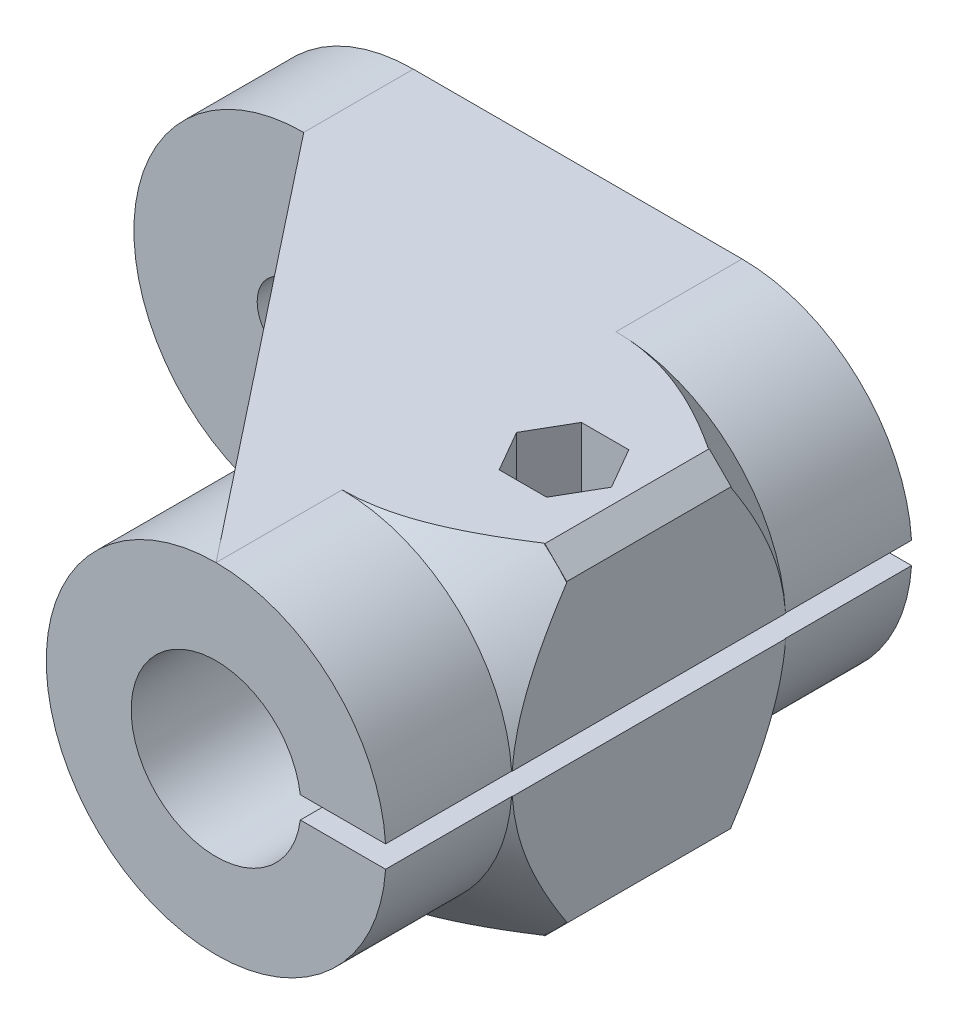
from build123d import *
from build123d.topology import SkipClean

# Parameters (mm, degrees)
SKETCH1_R                    = 7.75
BOSS_EXTRUDE1_DEPTH          = 48
CUT_EXTRUDE2_START           = -38
CUT_EXTRUDE2_DEPTH           = 38
BOSS_EXTRUDE4_DEPTH          = 3
BOSS_EXTRUDE5_DEPTH          = 7.5
SKETCH12_R                   = 2.25
CUT_EXTRUDE6_DEPTH           = 40
CUT_EXTRUDE7_DEPTH           = 8
SKETCH14_R                   = 3.75
CUT_EXTRUDE8_DEPTH           = 10
CUT_EXTRUDE_THIN2_DEPTH      = 68.930111237
CUT_EXTRUDE_THIN2_DEPTH_BACK = 63
SKETCH15_W                   = 30.528675624
SKETCH15_H                   = 2
CHAMFER4_SIZE                = 5
CHAMFER5_SIZE                = 2


with BuildPart() as part:
    # Sketch1 → Boss-Extrude1 (new body)
    with BuildSketch(Plane.XY):
        with BuildLine():
            Line((0, 15.5), (-30, 15.5))
            ThreePointArc((-30, 15.5), (-40.960155108, 10.960155108), (-45.5, 0))
            ThreePointArc((-45.5, 0), (-40.960155108, -10.960155108), (-30, -15.5))
            Line((-30, -15.5), (0, -15.5))
            ThreePointArc((0, -15.5), (10.960155108, -10.960155108), (15.5, 0))
            ThreePointArc((15.5, 0), (10.960155108, 10.960155108), (0, 15.5))
        make_face()
        Circle(SKETCH1_R, mode=Mode.SUBTRACT)
        with BuildLine():
            Line((-31, 3.25), (-29, 3.25))
            ThreePointArc((-29, 3.25), (-25.75, 0), (-29, -3.25))
            Line((-29, -3.25), (-31, -3.25))
            ThreePointArc((-31, -3.25), (-34.25, 0), (-31, 3.25))
        make_face(mode=Mode.SUBTRACT)
    extrude(amount=BOSS_EXTRUDE1_DEPTH)

    # Sketch4 → Cut-Extrude2 (cut)
    with SkipClean():  # the faces are left unmerged after this step: merging them gives an invalid solid
        with BuildSketch(Plane.XY.offset(48).offset(CUT_EXTRUDE2_START)):
            with BuildLine():
                Line((0, 15.5), (-30, 15.5))
                ThreePointArc((-30, 15.5), (-45.5, 0), (-30, -15.5))
                Line((-30, -15.5), (0, -15.5))
                ThreePointArc((0, -15.5), (-15.5, 0), (0, 15.5))
            make_face()
        extrude(amount=CUT_EXTRUDE2_DEPTH, mode=Mode.SUBTRACT)

    # Sketch10 → Boss-Extrude4 (add)
    with BuildSketch(Plane(origin=(0, 15.5, 0), x_dir=(1, 0, 0), z_dir=(0, 1, 0))):
        Polygon((-30, 0), (0, 0), (0, -48), (-30, -10), align=None)
    boss_extrude4 = extrude(amount=-BOSS_EXTRUDE4_DEPTH)

    # Mirror3: Boss-Extrude4 across plane
    add(boss_extrude4.mirror(Plane.ZX))

    # Sketch11 → Boss-Extrude5 (add, symmetric)
    with BuildSketch(Plane.XY.offset(24)):
        with BuildLine():
            Line((15.5, -15.5), (15.5, 0))
            ThreePointArc((15.5, 0), (10.960155108, -10.960155108), (0, -15.5))
            Line((0, -15.5), (15.5, -15.5))
        make_face()
        with BuildLine():
            Line((15.5, 15.5), (0, 15.5))
            ThreePointArc((0, 15.5), (10.960155108, 10.960155108), (15.5, 0))
            Line((15.5, 0), (15.5, 15.5))
        make_face()
    extrude(amount=BOSS_EXTRUDE5_DEPTH, both=True)

    # Sketch12 → Cut-Extrude6 (cut)
    with BuildSketch(Plane(origin=(0, -15.5, 0), x_dir=(-1, 0, 0), z_dir=(0, -1, 0))):
        with Locations((-7.75, -24)):
            Circle(SKETCH12_R)
    extrude(amount=-CUT_EXTRUDE6_DEPTH, mode=Mode.SUBTRACT)

    # Sketch13 → Cut-Extrude7 (cut)
    with BuildSketch(Plane(origin=(0, 15.5, 0), x_dir=(1, 0, 0), z_dir=(0, 1, 0))):
        Polygon((3.419872981, -24), (5.584936491, -27.75), (9.915063509, -27.75), (12.080127019, -24), (9.915063509, -20.25), (5.584936491, -20.25), align=None)
    extrude(amount=-CUT_EXTRUDE7_DEPTH, mode=Mode.SUBTRACT)

    # Sketch14 → Cut-Extrude8 (cut)
    with BuildSketch(Plane(origin=(0, -15.5, 0), x_dir=(-1, 0, 0), z_dir=(0, -1, 0))):
        with Locations((-7.75, -24)):
            Circle(SKETCH14_R)
    extrude(amount=-CUT_EXTRUDE8_DEPTH, mode=Mode.SUBTRACT)

    # Sketch15 → Cut-Extrude-Thin2 (cut, two sides: drawn at the far end of the back side and taken through both)
    with BuildSketch(Plane.XY.offset(48).offset(-CUT_EXTRUDE_THIN2_DEPTH_BACK)):
        with Locations((15.264337812, 0)):
            Rectangle(SKETCH15_W, SKETCH15_H)
    extrude(amount=CUT_EXTRUDE_THIN2_DEPTH + CUT_EXTRUDE_THIN2_DEPTH_BACK, mode=Mode.SUBTRACT)

    # Chamfer4
    chamfer4_edges = [part.edges().sort_by_distance(p)[0] for p in [
        (10.600707524, 11.308182878, 16.5),
    ]]
    chamfer(chamfer4_edges, length=CHAMFER4_SIZE)
    chamfer4_2_edges = [part.edges().sort_by_distance(p)[0] for p in [
        (10.600707524, 11.308182878, 31.5),
    ]]
    chamfer(chamfer4_2_edges, length=CHAMFER4_SIZE)
    chamfer4_3_edges = [part.edges().sort_by_distance(p)[0] for p in [
        (10.600707524, -11.308182878, 16.5),
    ]]
    chamfer(chamfer4_3_edges, length=CHAMFER4_SIZE)
    chamfer4_4_edges = [part.edges().sort_by_distance(p)[0] for p in [
        (10.600707524, -11.308182878, 31.5),
    ]]
    chamfer(chamfer4_4_edges, length=CHAMFER4_SIZE)

    # Chamfer5
    chamfer5_edges = [part.edges().sort_by_distance(p)[0] for p in [
        (15.5, 15.5, 24),
        (15.5, -15.5, 24),
    ]]
    chamfer(chamfer5_edges, length=CHAMFER5_SIZE)


solid = part.part
